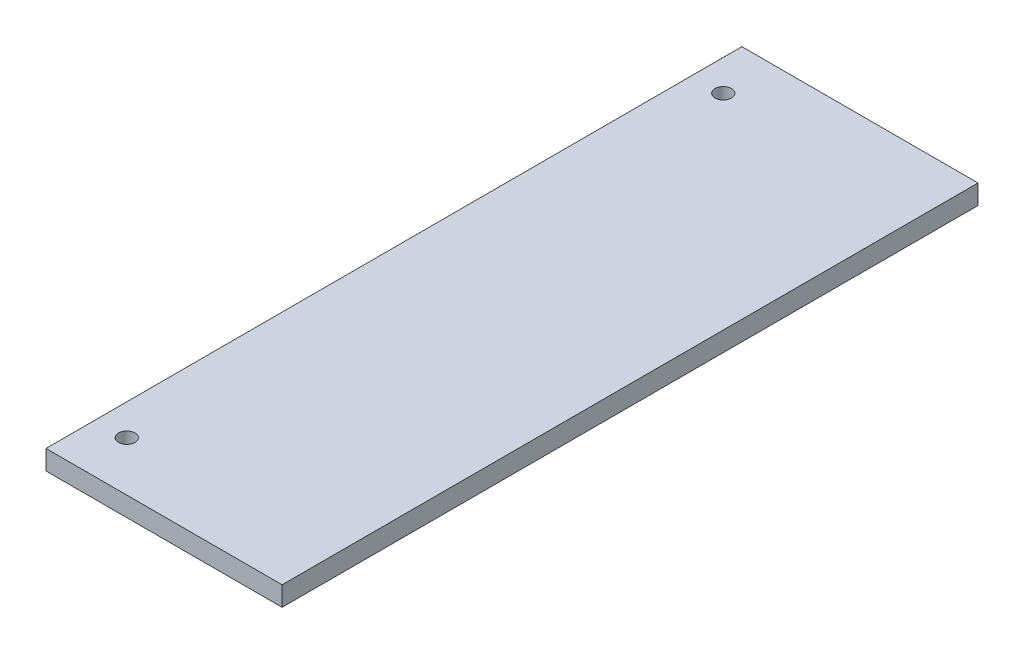
from build123d import *

# Parameters (mm, degrees)
SKETCH1_W           = 30.1625
SKETCH1_H           = 88.9
BOSS_EXTRUDE1_DEPTH = 2.5
SKETCH2_R           = 1.05
CUT_EXTRUDE1_DEPTH  = 48.005282698


with BuildPart() as part:
    # Sketch1 → Boss-Extrude1 (new body)
    with BuildSketch(Plane(origin=(0, 0, 0), x_dir=(1, 0, 0), z_dir=(0, 1, 0))):
        Rectangle(SKETCH1_W, SKETCH1_H)
    extrude(amount=BOSS_EXTRUDE1_DEPTH)

    # Sketch2 → Cut-Extrude1 (cut, through all)
    with BuildSketch(Plane(origin=(0, 2.5, 0), x_dir=(1, 0, 0), z_dir=(0, 1, 0))):
        with Locations((-11.1125, 38.1)):
            Circle(SKETCH2_R)
        with Locations((-11.1125, -38.1)):
            Circle(SKETCH2_R)
    extrude(amount=-CUT_EXTRUDE1_DEPTH, mode=Mode.SUBTRACT)


solid = part.part
